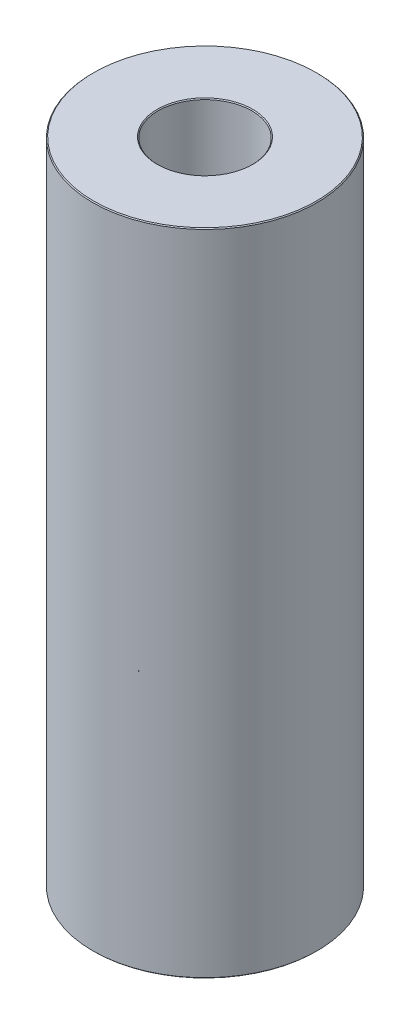
from build123d import *

# Parameters (mm, degrees)
SKETCH1_R           = 57.5
BOSS_EXTRUDE1_DEPTH = 333.026938855
SKETCH2_R           = 24.02418672
CUT_EXTRUDE1_DEPTH  = 343.811087923
CHAMFER1_SIZE       = 0.454243101


with BuildPart() as part:
    # Sketch1 → Boss-Extrude1 (new body)
    with BuildSketch(Plane(origin=(0, 0, 0), x_dir=(1, 0, 0), z_dir=(0, 1, 0))):
        Circle(SKETCH1_R)
    extrude(amount=BOSS_EXTRUDE1_DEPTH)

    # Sketch2 → Cut-Extrude1 (cut, through all)
    with BuildSketch(Plane(origin=(0, 0, 0), x_dir=(1, 0, 0), z_dir=(0, 1, 0))):
        Circle(SKETCH2_R)
    extrude(amount=CUT_EXTRUDE1_DEPTH, mode=Mode.SUBTRACT)

    # Chamfer1
    chamfer1_edges = [part.edges().sort_by_distance(p)[0] for p in [
        (-24.02418672, 333.026938855, 0),
        (-24.02418672, 0, 0),
        (-57.5, 0, 0),
        (-57.5, 333.026938855, 0),
    ]]
    chamfer(chamfer1_edges, length=CHAMFER1_SIZE)


solid = part.part
